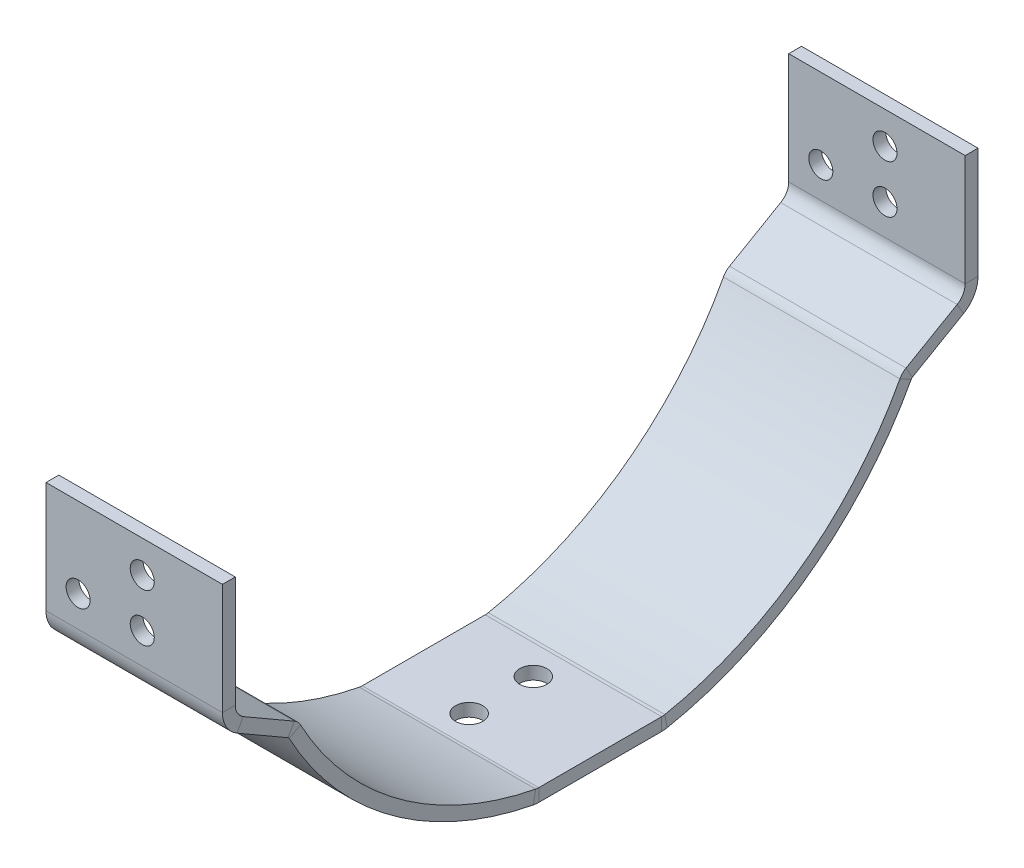
from build123d import *

# Parameters (mm, degrees)
BOSS_EXTRUDE1_DEPTH   = 22
FILLET1_R             = 2
F_3_0MM_DOWEL_HOLE2_D = 3
CONVERT_SOLID1_DEPTH  = 22
M3_CLEARANCE_HOLE1_D  = 3.4


# Read off the part's stored shape, not the designer's step: Convert-Solid1
with BuildPart() as part:
    # Sketch1 → Boss-Extrude1 (new body)
    with BuildSketch(Plane(origin=(0, 0, 0), x_dir=(0, 0, -1), z_dir=(1, 0, 0))):
        with BuildLine():
            Line((-45.5, -15), (-37.62592062, -19.54610185))
            ThreePointArc((-37.62592062, -19.54610185), (-25.286133167, -34.034856683), (-7.851953195, -41.666615306))
            Line((-7.851953195, -41.666615306), (7.851953195, -41.666615306))
            ThreePointArc((7.851953195, -41.666615306), (25.286133167, -34.034856683), (37.62592062, -19.54610185))
            Line((37.62592062, -19.54610185), (45.5, -15))
            Line((45.5, -15), (45.5, 0))
            Line((45.5, 0), (47.1, 0))
            Line((47.1, 0), (47.1, -15.923760431))
            Line((47.1, -15.923760431), (38.826379575, -20.70053741))
            ThreePointArc((38.826379575, -20.70053741), (25.990083184, -35.503740311), (8, -43.266615306))
            Line((8, -43.266615306), (-8, -43.266615306))
            ThreePointArc((-8, -43.266615306), (-25.990083184, -35.503740311), (-38.826379575, -20.70053741))
            Line((-38.826379575, -20.70053741), (-47.1, -15.923760431))
            Line((-47.1, -15.923760431), (-47.1, 0))
            Line((-47.1, 0), (-45.5, 0))
            Line((-45.5, 0), (-45.5, -15))
        make_face()
    extrude(amount=BOSS_EXTRUDE1_DEPTH)

    # Fillet1
    fillet1_edges = [part.edges().sort_by_distance(p)[0] for p in [
        (11, -15.923760431, 47.1),
        (11, -15, 45.5),
        (11, -19.54610185, 37.62592062),
        (11, -41.666615306, 7.851953195),
        (11, -41.666615306, -7.851953195),
        (11, -19.54610185, -37.62592062),
        (11, -15, -45.5),
        (11, -15.923760431, -47.1),
        (11, -20.70053741, -38.826379575),
        (11, -43.266615306, -8),
        (11, -43.266615306, 8),
        (11, -20.70053741, 38.826379575),
    ]]
    fillet(fillet1_edges, radius=FILLET1_R)

    # Ø3.0mm Dowel Hole2 (through all)
    with Locations(Plane.XY.offset(47.1)):
        with Locations((4, -10), (12, -10), (12, -4)):
            Hole(F_3_0MM_DOWEL_HOLE2_D / 2)

    # Convert-Solid1 outline → Convert-Solid1 (cut)
    with BuildSketch(Plane.YZ):
        with BuildLine():
            ThreePointArc((-13.845299462, -47.1), (-15.645299462, -46.617691454), (-16.962990915, -45.3))
            Line((-16.962990915, -45.3), (-16.5011107, -46.1))
            ThreePointArc((-16.5011107, -46.1), (-15.769059892, -46.832050808), (-14.769059892, -47.1))
            Line((-14.769059892, -47.1), (-13.845299462, -47.1))
        make_face()
        with BuildLine():
            Line((-16.5011107, 46.1), (-16.962990915, 45.3))
            ThreePointArc((-16.962990915, 45.3), (-15.645299462, 46.617691454), (-13.845299462, 47.1))
            Line((-13.845299462, 47.1), (-14.769059892, 47.1))
            ThreePointArc((-14.769059892, 47.1), (-15.769059892, 46.832050808), (-16.5011107, 46.1))
        make_face()
        with BuildLine():
            ThreePointArc((-20.41783584, 39.316033057), (-20.750751076, 38.886900575), (-21.186848098, 38.563162055))
            ThreePointArc((-21.186848098, 38.563162055), (-20.994067, 38.668451622), (-20.800762672, 38.772777464))
            ThreePointArc((-20.800762672, 38.772777464), (-20.711463806, 38.838037356), (-20.643450353, 38.925257259))
            Line((-20.643450353, 38.925257259), (-20.41783584, 39.316033057))
        make_face()
        with BuildLine():
            Line((-43.266615306, 7.814503261), (-43.266615306, 7.662873495))
            ThreePointArc((-43.266615306, 7.662873495), (-43.250240286, 8.005848713), (-43.201264194, 8.345703806))
            ThreePointArc((-43.201264194, 8.345703806), (-43.216551408, 8.266177136), (-43.231692225, 8.186622464))
            ThreePointArc((-43.231692225, 8.186622464), (-43.257865395, 8.001380442), (-43.266615306, 7.814503261))
        make_face()
        with BuildLine():
            ThreePointArc((-43.231692225, -8.186622464), (-43.216551408, -8.266177136), (-43.201264194, -8.345703806))
            ThreePointArc((-43.201264194, -8.345703806), (-43.250240286, -8.005848713), (-43.266615306, -7.662873495))
            Line((-43.266615306, -7.662873495), (-43.266615306, -7.814503261))
            ThreePointArc((-43.266615306, -7.814503261), (-43.257865395, -8.001380442), (-43.231692225, -8.186622464))
        make_face()
        with BuildLine():
            ThreePointArc((-21.186848098, -38.563162055), (-20.750751076, -38.886900575), (-20.41783584, -39.316033057))
            Line((-20.41783584, -39.316033057), (-20.643450353, -38.925257259))
            ThreePointArc((-20.643450353, -38.925257259), (-20.711463806, -38.838037356), (-20.800762672, -38.772777464))
            ThreePointArc((-20.800762672, -38.772777464), (-20.994067, -38.668451622), (-21.186848098, -38.563162055))
        make_face()
    extrude(amount=CONVERT_SOLID1_DEPTH, mode=Mode.SUBTRACT)

    # M3 Clearance Hole1 (through all)
    with Locations(Plane(origin=(0, -41.666615306, 0), x_dir=(1, 0, 0), z_dir=(0, 1, 0))):
        with Locations((9.658073919, -4.00254861), (9.658073919, 3.99745139)):
            Hole(M3_CLEARANCE_HOLE1_D / 2)


solid = part.part
